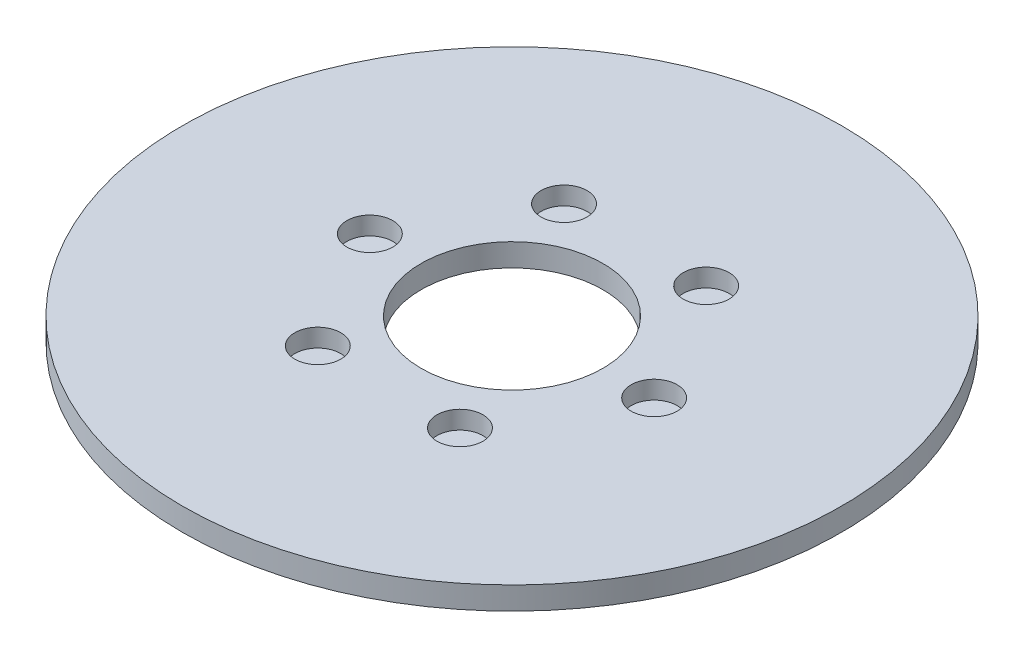
from build123d import *

# Parameters (mm, degrees)
SKETCH1_R           = 72.5
BOSS_EXTRUDE1_DEPTH = 5
SKETCH2_R           = 20
CUT_EXTRUDE1_DEPTH  = 103.652325838
SKETCH3_R           = 5.052350851
CUT_EXTRUDE2_DEPTH  = 3.980044721
CIRPATTERN1_COUNT   = 6


with BuildPart() as part:
    # Sketch1 → Boss-Extrude1 (new body)
    with BuildSketch(Plane(origin=(0, 0, 0), x_dir=(1, 0, 0), z_dir=(0, 1, 0))):
        Circle(SKETCH1_R)
    extrude(amount=BOSS_EXTRUDE1_DEPTH)

    # Sketch2 → Cut-Extrude1 (cut, through all)
    with BuildSketch(Plane(origin=(0, 0, 0), x_dir=(1, 0, 0), z_dir=(0, 1, 0))):
        Circle(SKETCH2_R)
    extrude(amount=CUT_EXTRUDE1_DEPTH, mode=Mode.SUBTRACT)

    # Sketch3 → Cut-Extrude2 (cut)
    with BuildSketch(Plane(origin=(0, 5, 0), x_dir=(1, 0, 0), z_dir=(0, 1, 0))):
        with Locations((-31.271857753, 0)):
            Circle(SKETCH3_R)
    cut_extrude2 = extrude(amount=-CUT_EXTRUDE2_DEPTH, mode=Mode.SUBTRACT)

    # CirPattern1: Cut-Extrude2 ×6 about axis
    cirpattern1_axis = Axis((0, 0, 0), (0, 1, 0))
    for i in range(1, CIRPATTERN1_COUNT):
        add(cut_extrude2.rotate(cirpattern1_axis, i * 360 / CIRPATTERN1_COUNT), mode=Mode.SUBTRACT)


solid = part.part
